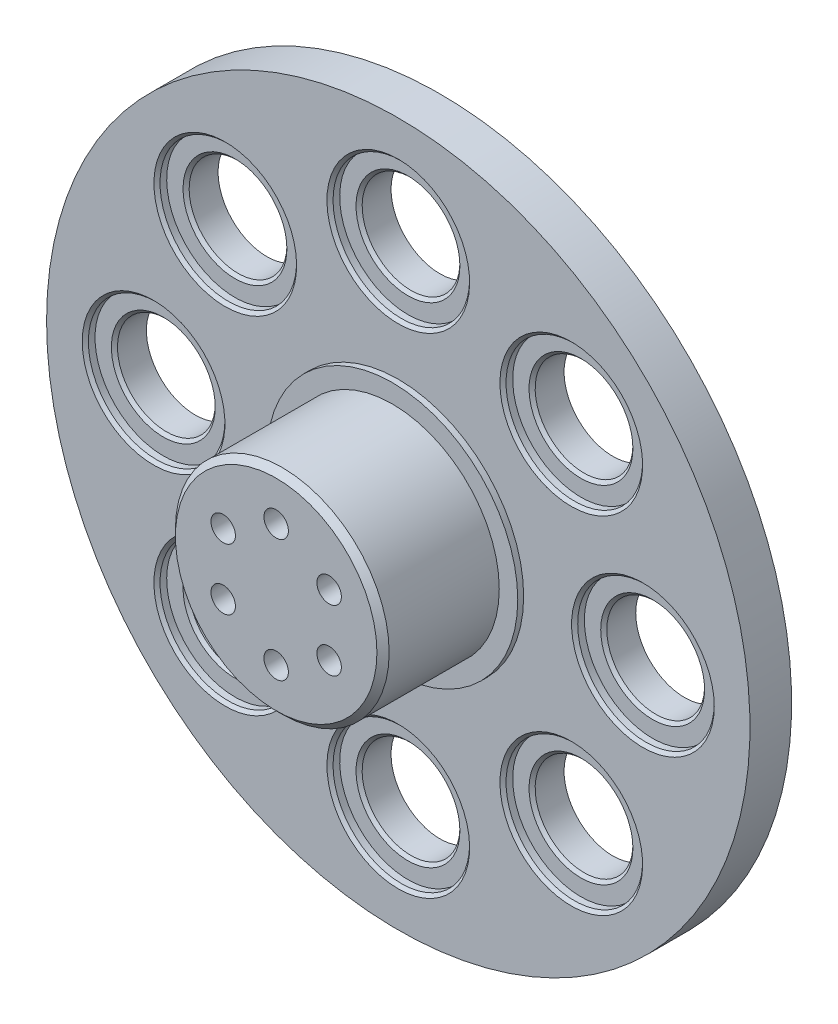
from build123d import *

# Parameters (mm, degrees)
SKETCH1_R                    = 17.475
BOSS_EXTRUDE1_DEPTH          = 19
SKETCH7_R                    = 20.5
BOSS_EXTRUDE3_DEPTH          = 0.9625
SKETCH3_R                    = 57.5
BOSS_EXTRUDE2_DEPTH          = 6.8125
SKETCH4_R                    = 11.0375
CUT_EXTRUDE1_DEPTH           = 7
SKETCH5_R                    = 7.5
CUT_EXTRUDE2_DEPTH           = 0.5
SKETCH6_R                    = 2
CUT_EXTRUDE3_DEPTH           = 10
CIRPATTERN1_COUNT            = 6
CHAMFER1_SIZE                = 1
SKETCH8_R                    = 7.99
CUT_EXTRUDE4_DEPTH           = 84.731722819
SKETCH9_R                    = 11.1625
CUT_EXTRUDE5_DEPTH           = 1.5875
CHAMFER2_SIZE                = 0.5
CHAMFER3_SIZE                = 0.5
CIRPATTERN2_COUNT            = 8
CHAMFER2_OF_CIRPATTERN2_SIZE = 0.5
CHAMFER3_OF_CIRPATTERN2_SIZE = 0.5


with BuildPart() as part:
    # Sketch1 → Boss-Extrude1 (new body)
    with BuildSketch(Plane.XY):
        Circle(SKETCH1_R)
    extrude(amount=BOSS_EXTRUDE1_DEPTH)

    # Sketch7 → Boss-Extrude3 (add)
    with BuildSketch(Plane(origin=(0, 0, 0), x_dir=(-1, 0, 0), z_dir=(0, 0, -1))):
        Circle(SKETCH7_R)
    extrude(amount=BOSS_EXTRUDE3_DEPTH)

    # Sketch3 → Boss-Extrude2 (add)
    with BuildSketch(Plane(origin=(0, 0, -0.9625), x_dir=(-1, 0, 0), z_dir=(0, 0, -1))):
        Circle(SKETCH3_R)
    extrude(amount=BOSS_EXTRUDE2_DEPTH)

    # Sketch4 → Cut-Extrude1 (cut)
    with BuildSketch(Plane(origin=(0, 0, -7.775), x_dir=(-1, 0, 0), z_dir=(0, 0, -1))):
        Circle(SKETCH4_R)
    extrude(amount=-CUT_EXTRUDE1_DEPTH, mode=Mode.SUBTRACT)

    # Sketch5 → Cut-Extrude2 (cut)
    with BuildSketch(Plane(origin=(0, 0, -0.775), x_dir=(-1, 0, 0), z_dir=(0, 0, -1))):
        Circle(SKETCH5_R)
    extrude(amount=-CUT_EXTRUDE2_DEPTH, mode=Mode.SUBTRACT)

    # Sketch6 → Cut-Extrude3 (cut)
    with BuildSketch(Plane.XY.offset(19)):
        with Locations((0, 10)):
            Circle(SKETCH6_R)
    cut_extrude3 = extrude(amount=-CUT_EXTRUDE3_DEPTH, mode=Mode.SUBTRACT)

    # CirPattern1: Cut-Extrude3 ×6 about axis
    cirpattern1_axis = Axis((0, 0, 19), (0, 0, 1))
    for i in range(1, CIRPATTERN1_COUNT):
        add(cut_extrude3.rotate(cirpattern1_axis, i * 360 / CIRPATTERN1_COUNT), mode=Mode.SUBTRACT)

    # Chamfer1
    chamfer1_edges = [part.edges().sort_by_distance(p)[0] for p in [
        (11.0375, 0, -7.775),
        (-17.475, 0, 19),
    ]]
    chamfer(chamfer1_edges, length=CHAMFER1_SIZE)

    # Sketch8 → Cut-Extrude4 (cut, through all)
    with BuildSketch(Plane.XY.offset(-0.9625)):
        with Locations((-40, 0)):
            Circle(SKETCH8_R)
    cut_extrude4 = extrude(amount=-CUT_EXTRUDE4_DEPTH, mode=Mode.SUBTRACT)

    # Sketch9 → Cut-Extrude5 (cut)
    with BuildSketch(Plane.XY.offset(-0.9625)):
        with Locations((-40, 0)):
            Circle(SKETCH9_R)
    cut_extrude5 = extrude(amount=-CUT_EXTRUDE5_DEPTH, mode=Mode.SUBTRACT)

    # Chamfer2
    chamfer2_edges = [part.edges().sort_by_distance(p)[0] for p in [
        (-47.99, 0, -2.55),
    ]]
    chamfer(chamfer2_edges, length=CHAMFER2_SIZE)

    # Chamfer3
    chamfer3_edges = [part.edges().sort_by_distance(p)[0] for p in [
        (-51.1625, 0, -0.9625),
    ]]
    chamfer(chamfer3_edges, length=CHAMFER3_SIZE)

    # CirPattern2: Cut-Extrude4, Cut-Extrude5 ×8 about axis
    cirpattern2_axis = Axis((0, 0, -0.9625), (0, 0, -1))
    add([cut_extrude4.rotate(cirpattern2_axis, i * 360 / CIRPATTERN2_COUNT) for i in range(1, CIRPATTERN2_COUNT)], mode=Mode.SUBTRACT)
    add([cut_extrude5.rotate(cirpattern2_axis, i * 360 / CIRPATTERN2_COUNT) for i in range(1, CIRPATTERN2_COUNT)], mode=Mode.SUBTRACT)

    # Chamfer2 of CirPattern2
    chamfer2_of_cirpattern2_edges = [part.edges().sort_by_distance(p)[0] for p in [
        (-33.934054429, 33.934054429, -2.55),
        (0, 47.99, -2.55),
        (33.934054429, 33.934054429, -2.55),
        (47.99, 0, -2.55),
        (33.934054429, -33.934054429, -2.55),
        (0, -47.99, -2.55),
        (-33.934054429, -33.934054429, -2.55),
    ]]
    chamfer(chamfer2_of_cirpattern2_edges, length=CHAMFER2_OF_CIRPATTERN2_SIZE)

    # Chamfer3 of CirPattern2
    chamfer3_of_cirpattern2_edges = [part.edges().sort_by_distance(p)[0] for p in [
        (-36.177350692, 36.177350692, -0.9625),
        (0, 51.1625, -0.9625),
        (36.177350692, 36.177350692, -0.9625),
        (51.1625, 0, -0.9625),
        (36.177350692, -36.177350692, -0.9625),
        (0, -51.1625, -0.9625),
        (-36.177350692, -36.177350692, -0.9625),
    ]]
    chamfer(chamfer3_of_cirpattern2_edges, length=CHAMFER3_OF_CIRPATTERN2_SIZE)


solid = part.part
